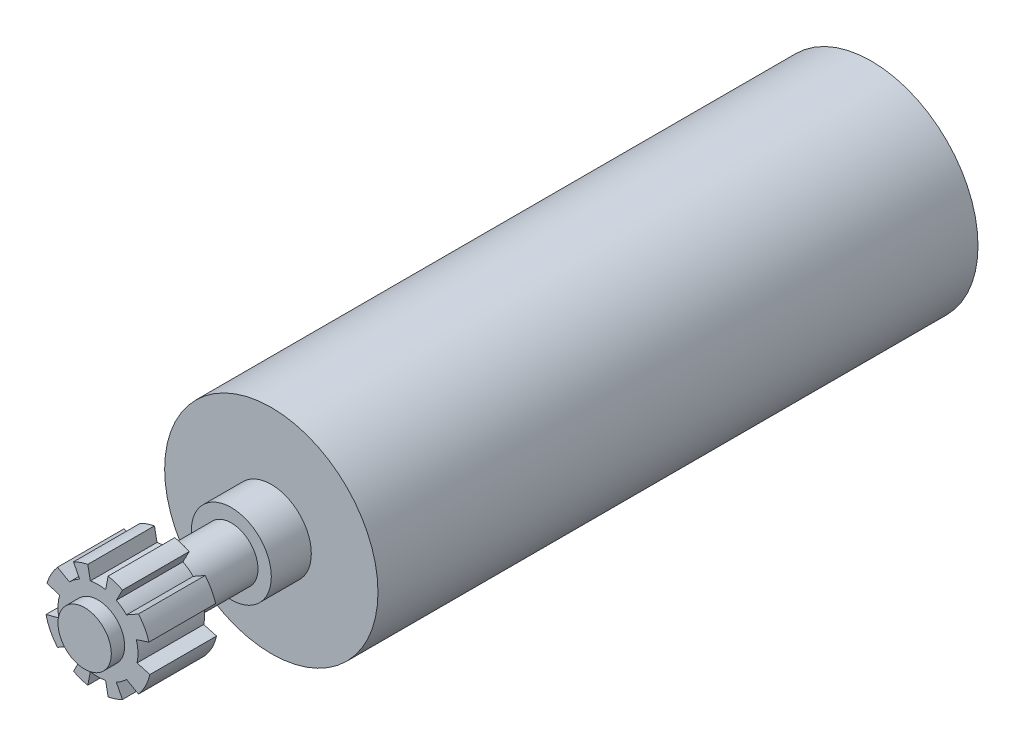
from build123d import *

# Parameters (mm, degrees)
ESBO_O1_R                = 8
RESSALTO_EXTRUS_O1_DEPTH = 45
ESBO_O2_R                = 3
RESSALTO_EXTRUS_O2_DEPTH = 3
ESBO_O3_R                = 2
RESSALTO_EXTRUS_O3_DEPTH = 5
ESBO_O4_R                = 4
RESSALTO_EXTRUS_O4_DEPTH = 5
ESBO_O5_R                = 2
RESSALTO_EXTRUS_O5_DEPTH = 1
CORTE_EXTRUS_O11_START   = -5
CORTE_EXTRUS_O11_DEPTH   = 5


# Read off the part's stored shape, not the designer's step: Corte-extrusão11
with BuildPart() as part:
    # Esboço1 → Ressalto-extrusão1 (new body)
    with BuildSketch(Plane.XY):
        with Locations(Location((0, 0, 0), (0, 0, 180))):
            Circle(ESBO_O1_R)
    extrude(amount=RESSALTO_EXTRUS_O1_DEPTH)

    # Esboço2 → Ressalto-extrusão2 (add)
    with BuildSketch(Plane.XY.offset(45)):
        Circle(ESBO_O2_R)
    extrude(amount=RESSALTO_EXTRUS_O2_DEPTH)

    # Esboço3 → Ressalto-extrusão3 (add)
    with BuildSketch(Plane.XY.offset(48)):
        Circle(ESBO_O3_R)
    extrude(amount=RESSALTO_EXTRUS_O3_DEPTH)

    # Esboço4 → Ressalto-extrusão4 (add)
    with BuildSketch(Plane.XY.offset(53)):
        Circle(ESBO_O4_R)
    extrude(amount=RESSALTO_EXTRUS_O4_DEPTH)

    # Esboço5 → Ressalto-extrusão5 (add)
    with BuildSketch(Plane.XY.offset(58)):
        Circle(ESBO_O5_R)
    extrude(amount=RESSALTO_EXTRUS_O5_DEPTH)

    # Corte-extrusão11 outline → Corte-extrusão11 (cut)
    with BuildSketch(Plane.XY.offset(58).offset(CORTE_EXTRUS_O11_START)):
        with BuildLine():
            ThreePointArc((-0.572247027, 2.944916525), (3.275e-06, 3), (0.572253456, 2.944915276))
            Line((0.572253456, 2.944915276), (0.763004609, 3.926553701))
            ThreePointArc((0.763004609, 3.926553701), (4.366e-06, 4), (-0.762996037, 3.926555367))
            Line((-0.762996037, 3.926555367), (-0.572247027, 2.944916525))
        make_face()
        with BuildLine():
            ThreePointArc((3.037246914, 2.602908216), (2.483346926, 3.135759564), (1.837759325, 3.552835581))
            Line((1.837759325, 3.552835581), (1.376093618, 2.660323526))
            ThreePointArc((1.376093618, 2.660323526), (1.780577016, 2.408422803), (2.139992834, 2.095563308))
            Line((2.139992834, 2.095563308), (3.037246914, 2.602908216))
        make_face()
        with BuildLine():
            Line((-1.376093618, 2.660323526), (-1.837759325, 3.552835581))
            ThreePointArc((-1.837759325, 3.552835581), (-2.483346926, 3.135759564), (-3.037246914, 2.602908216))
            Line((-3.037246914, 2.602908216), (-2.139992834, 2.095563308))
            ThreePointArc((-2.139992834, 2.095563308), (-1.780577016, 2.408422803), (-1.376093618, 2.660323526))
        make_face()
        with BuildLine():
            ThreePointArc((3.898015048, -0.897484644), (3.997519889, 0.140835844), (3.825190717, 1.169579401))
            Line((3.825190717, 1.169579401), (2.873235611, 0.857757981))
            ThreePointArc((2.873235611, 0.857757981), (2.996308475, 0.115616418), (2.93078938, -0.633802208))
            Line((2.93078938, -0.633802208), (3.898015048, -0.897484644))
        make_face()
        with BuildLine():
            Line((-2.873235611, 0.857757981), (-3.825190717, 1.169579401))
            ThreePointArc((-3.825190717, 1.169579401), (-3.997519889, 0.140835844), (-3.898015048, -0.897484644))
            Line((-3.898015048, -0.897484644), (-2.93078938, -0.633802208))
            ThreePointArc((-2.93078938, -0.633802208), (-2.996308475, 0.115616418), (-2.873235611, 0.857757981))
        make_face()
        with BuildLine():
            Line((-2.139992834, -2.095563308), (-3.037246914, -2.602908216))
            ThreePointArc((-3.037246914, -2.602908216), (-2.483346926, -3.135759564), (-1.837759325, -3.552835581))
            Line((-1.837759325, -3.552835581), (-1.376093618, -2.660323526))
            ThreePointArc((-1.376093618, -2.660323526), (-1.780577016, -2.408422803), (-2.139992834, -2.095563308))
        make_face()
        with BuildLine():
            ThreePointArc((1.837759325, -3.552835581), (2.483346926, -3.135759564), (3.037246914, -2.602908216))
            Line((3.037246914, -2.602908216), (2.139992834, -2.095563308))
            ThreePointArc((2.139992834, -2.095563308), (1.780577016, -2.408422803), (1.376093618, -2.660323526))
            Line((1.376093618, -2.660323526), (1.837759325, -3.552835581))
        make_face()
        with BuildLine():
            Line((-0.572247027, -2.944916525), (-0.762996037, -3.926555367))
            ThreePointArc((-0.762996037, -3.926555367), (4.366e-06, -4), (0.763004609, -3.926553701))
            Line((0.763004609, -3.926553701), (0.572253456, -2.944915276))
            ThreePointArc((0.572253456, -2.944915276), (3.275e-06, -3), (-0.572247027, -2.944916525))
        make_face()
    extrude(amount=CORTE_EXTRUS_O11_DEPTH, mode=Mode.SUBTRACT)


solid = part.part
